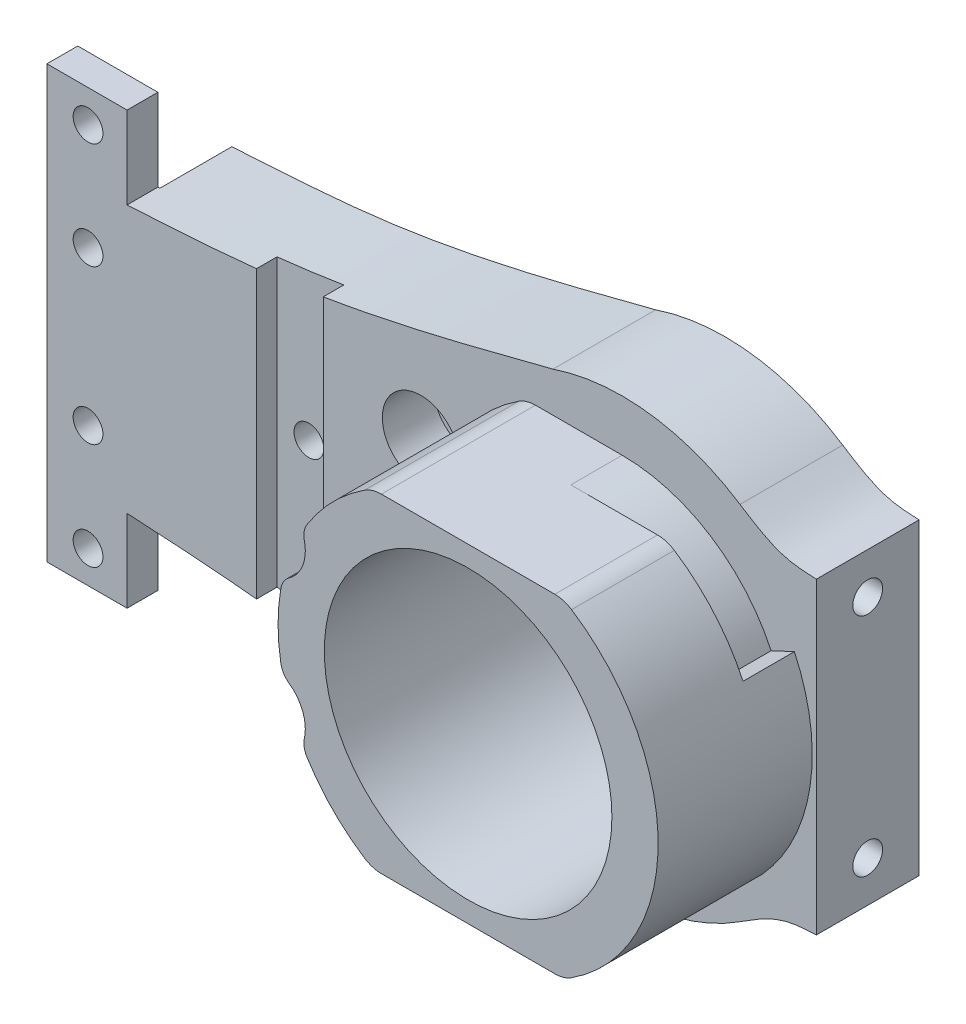
from build123d import *

# Parameters (mm, degrees)
SKETCH1_R                                     = 14
EXTRUDE1_DEPTH                                = 10
SKETCH3_R                                     = 18.5
SKETCH3_R_2                                   = 14
EXTRUDE2_DEPTH                                = 15
EXTRUDE3_DEPTH                                = 7
CBORE_FOR_M3_PAN_HEAD_MACHINE_SCREW1_AT_COUNT = 2
CBORE_FOR_M3_PAN_HEAD_MACHINE_SCREW1_AT_PITCH = 14.99999999999997
EXTRUDE4_START                                = 20
SKETCH6_R                                     = 3.7499999999999996
EXTRUDE4_DEPTH                                = 20
FILLET1_R                                     = 2
SKETCH8_W                                     = 18.574175621006713
SKETCH8_H                                     = 7.448846743952753
EXTRUDE5_DEPTH                                = 15
FILLET2_R                                     = 3
EXTRUDE8_DEPTH                                = 5
F_2_9_2_9_DIAMETER_HOLE1_D                    = 2.9
F_2_9_2_9_DIAMETER_HOLE1_DEPTH                = 10
SKETCH14_W                                    = 6.5
SKETCH14_H                                    = 44.553858890679976
EXTRUDE9_DEPTH                                = 2
SKETCH15_R                                    = 1.45
EXTRUDE10_DEPTH                               = 10
SKETCH16_R                                    = 1.45
EXTRUDE11_DEPTH                               = 6


with BuildPart() as part:
    # Sketch1 → Extrude1 (new body)
    with BuildSketch(Plane.XY):
        with BuildLine():
            Line((-30, 21), (-22.199999999999996, 21))
            Line((-22.199999999999996, 21), (-22.199999999999996, 13.000000000000002))
            add(Edge.make_bspline(
                [(-22.199999999999996, 13.000000000000002), (-17.087298132677002, 13.293403264574941), (-3.0476406189760237, 14.099098854681937), (10.587905202926116, 17.638075889977564), (19.257911052248826, 19.88829395952834)],
                knots=[0, 0, 0, 0, 0.36416143786510685, 1, 1, 1, 1], degree=3))
            ThreePointArc((19.257911052248826, 19.88829395952834), (28.628449534780575, 20.83485668400702), (37.47030029247324, 17.590685353347904))
            add(Edge.make_bspline(
                [(44.90000000000001, 15), (43.95984253847409, 15.041510539741976), (41.267922149986155, 15.160366234496765), (38.96737663845901, 16.632619120705193), (37.47030029247324, 17.590685353347904)],
                knots=[0, 0, 0, 0, 0.3492515846852426, 1, 1, 1, 1], degree=3))
            Line((44.90000000000001, 15), (44.90000000000001, -15))
            add(Edge.make_bspline(
                [(44.90000000000001, -15), (43.95984253847409, -15.041510539741976), (41.267922149986155, -15.160366234496761), (38.96737663845901, -16.632619120705193), (37.47030029247324, -17.590685353347904)],
                knots=[0, 0, 0, 0, 0.3492515846852426, 1, 1, 1, 1], degree=3))
            ThreePointArc((37.47030029247324, -17.590685353347904), (28.628449534780575, -20.834856684007015), (19.257911052248826, -19.88829395952834))
            add(Edge.make_bspline(
                [(-22.199999999999996, -13.000000000000002), (-17.087298132677002, -13.293403264574941), (-3.0476406189760232, -14.099098854681936), (10.587905202926116, -17.638075889977564), (19.257911052248826, -19.88829395952834)],
                knots=[0, 0, 0, 0, 0.36416143786510685, 1, 1, 1, 1], degree=3))
            Line((-22.199999999999996, -13.000000000000002), (-22.199999999999996, -21))
            Line((-22.199999999999996, -21), (-30, -21))
            Line((-30, -21), (-30, 21))
        make_face()
        with Locations((26.000000000000004, 0)):
            Circle(SKETCH1_R, mode=Mode.SUBTRACT)
    extrude(amount=EXTRUDE1_DEPTH)

    # Sketch3 → Extrude2 (add)
    with BuildSketch(Plane.XY.offset(10)):
        with Locations(Location((26.000000000000004, 0, 0), (0, 0, 180))):
            Circle(SKETCH3_R)
        with Locations((26.000000000000004, 0)):
            Circle(SKETCH3_R_2, mode=Mode.SUBTRACT)
    extrude(amount=EXTRUDE2_DEPTH)

    # Sketch4 → Extrude3 (cut)
    with BuildSketch(Plane(origin=(0, 0, 0), x_dir=(-1, 0, 0), z_dir=(0, 0, -1))):
        Polygon((30, 23.412577815179247), (22, 23.412577815179247), (22.000000000000007, -25.98666339363831), (30.000000000000007, -25.98666339363831), align=None)
    extrude(amount=-EXTRUDE3_DEPTH, mode=Mode.SUBTRACT)

    # Sketch5 → CBORE for M3 Pan Head Machine Screw1 (revolve, cut)
    with BuildSketch(Plane(origin=(6.399999999999998, 7.499999999999986, 10), x_dir=(0, -1, 0), z_dir=(1, 0, 0))):
        Polygon((0, 0), (-2.45e-15, 9.999999999999998), (1.7999999999999978, 10), (1.7999999999999994, 4.999999999999999), (3.749999999999999, 4.999999999999999), (3.75, 0), align=None)
    cbore_for_m3_pan_head_machine_screw1 = revolve(axis=Axis((6.399999999999998, 7.499999999999986, 16.34999999999999), (0, 0, -1)), mode=Mode.SUBTRACT)

    # CBORE for M3 Pan Head Machine Screw1 at: CBORE for M3 Pan Head Machine Screw1 ×2
    with Locations(*[(0, -i * CBORE_FOR_M3_PAN_HEAD_MACHINE_SCREW1_AT_PITCH, 0) for i in range(1, CBORE_FOR_M3_PAN_HEAD_MACHINE_SCREW1_AT_COUNT)]):
        add(cbore_for_m3_pan_head_machine_screw1, mode=Mode.SUBTRACT)

    # Sketch6 → Extrude4 (cut)
    with BuildSketch(Plane.XY.offset(10).offset(EXTRUDE4_START)):
        with Locations((6.399999999999998, 7.499999999999986)):
            Circle(SKETCH6_R)
        with Locations((6.399999999999998, -7.499999999999984)):
            Circle(SKETCH6_R)
    extrude(amount=-EXTRUDE4_DEPTH, mode=Mode.SUBTRACT)

    # Fillet1
    fillet1_edges = [part.edges().sort_by_distance(p)[0] for p in [
        (7.957487706286119, -4.088734539094374, 17.5),
        (9.836860741750934, -9.000162738442441, 17.5),
        (9.836860741750938, 9.000162738442443, 17.5),
        (7.957487706286121, 4.088734539094375, 17.5),
    ]]
    fillet(fillet1_edges, radius=FILLET1_R)

    # Sketch8 → Extrude5 (cut)
    with BuildSketch(Plane.XY.offset(25)):
        with Locations((26, 19.72442337197638)):
            Rectangle(SKETCH8_W, SKETCH8_H)
        with Locations((26, -19.72442337197638)):
            Rectangle(SKETCH8_W, SKETCH8_H)
    extrude(amount=-EXTRUDE5_DEPTH, mode=Mode.SUBTRACT)

    # Fillet2
    fillet2_edges = [part.edges().sort_by_distance(p)[0] for p in [
        (35.28708781050336, 16, 17.5),
        (16.712912189496645, 16, 17.5),
        (35.28708781050336, -16, 17.5),
        (16.712912189496645, -16, 17.5),
    ]]
    fillet(fillet2_edges, radius=FILLET2_R)

    # Sketch11 → Extrude8 (cut)
    with BuildSketch(Plane.XY.offset(10)):
        with BuildLine():
            Line((26.000000000000004, 16.000000000000004), (26.000000000000004, 18.999999999999996))
            ThreePointArc((26.000000000000004, 18.999999999999996), (36.206280080860964, 16.025974132982387), (43.21742953366855, 8.034931253791655))
            Line((43.21742953366855, 8.034931253791655), (40.49888802835247, 6.766257897929818))
            ThreePointArc((40.49888802835247, 6.766257897929818), (34.5947621733566, 13.495557164616752), (26.000000000000004, 16.000000000000004))
        make_face()
        with BuildLine():
            Line((26.000000000000004, -16.000000000000004), (26.000000000000004, -18.999999999999996))
            ThreePointArc((26.000000000000004, -18.999999999999996), (15.793719919139045, -16.025974132982395), (8.782570466331453, -8.034931253791656))
            Line((8.782570466331453, -8.034931253791656), (11.501111971647536, -6.766257897929817))
            ThreePointArc((11.501111971647536, -6.766257897929817), (17.405237826643408, -13.495557164616757), (26.000000000000004, -16.000000000000004))
        make_face()
    extrude(amount=EXTRUDE8_DEPTH, mode=Mode.SUBTRACT)

    # Ø2.9 (2.9) Diameter Hole1
    with Locations(Plane(origin=(-26, -17.85, 10), x_dir=(1, 0, 0), z_dir=(0, 0, 1))):
        with Locations((0, 0), (0, 10.35), (0, 25.35), (0, 35.7)):
            Hole(F_2_9_2_9_DIAMETER_HOLE1_D / 2, depth=F_2_9_2_9_DIAMETER_HOLE1_DEPTH)

    # Sketch14 → Extrude9 (cut)
    with BuildSketch(Plane.XY.offset(10)):
        with Locations((-6.350000000000001, -1.057050154528838)):
            Rectangle(SKETCH14_W, SKETCH14_H)
    extrude(amount=-EXTRUDE9_DEPTH, mode=Mode.SUBTRACT)

    # Sketch15 → Extrude10 (cut)
    with BuildSketch(Plane.XY.offset(8)):
        with Locations((-6.500000000000001, 1.73e-15)):
            Circle(SKETCH15_R)
    extrude(amount=-EXTRUDE10_DEPTH, mode=Mode.SUBTRACT)

    # Sketch16 → Extrude11 (cut)
    with BuildSketch(Plane(origin=(44.90000000000001, 0, 0), x_dir=(0, 0, -1), z_dir=(1, 0, 0))):
        with Locations((-5, -11)):
            Circle(SKETCH16_R)
        with Locations((-5, 11)):
            Circle(SKETCH16_R)
    extrude(amount=-EXTRUDE11_DEPTH, mode=Mode.SUBTRACT)


solid = part.part
